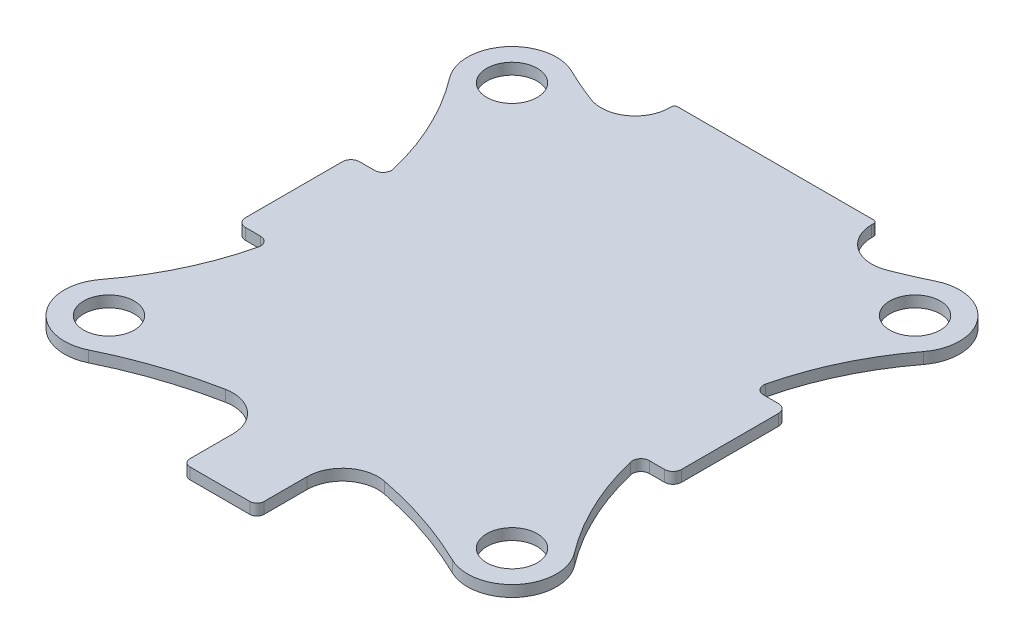
from build123d import *

# Parameters (mm, degrees)
SKETCH1_R           = 2.25
BOSS_EXTRUDE2_DEPTH = 1


with BuildPart() as part:
    # Sketch1 → Boss-Extrude2 (new body)
    with BuildSketch(Plane(origin=(0, 0, 0), x_dir=(1, 0, 0), z_dir=(0, 1, 0))):
        with BuildLine():
            Line((-18.669, -5.08), (-17.330956316, -5.08))
            ThreePointArc((-17.330956316, -5.08), (-16.732344988, -5.370503999), (-16.590161442, -6.020513179))
            ThreePointArc((-16.590161442, -6.020513179), (-18.359695736, -11.0243031), (-21.119367367, -15.557886415))
            ThreePointArc((-21.119367367, -15.557886415), (-21.028176895, -20.478529347), (-16.219689319, -21.527094936))
            ThreePointArc((-16.219689319, -21.527094936), (-11.752669663, -19.697385754), (-7.085365092, -18.465164862))
            ThreePointArc((-7.085365092, -18.465164862), (-4.458452771, -19.130602125), (-3.302, -21.581335094))
            Line((-3.302, -21.581335094), (-3.302, -25.4))
            ThreePointArc((-3.302, -25.4), (-3.116012806, -25.849012806), (-2.667, -26.035))
            Line((-2.667, -26.035), (2.667, -26.035))
            ThreePointArc((2.667, -26.035), (3.116012806, -25.849012806), (3.302, -25.4))
            Line((3.302, -25.4), (3.302, -21.581335094))
            ThreePointArc((3.302, -21.581335094), (4.458452771, -19.130602125), (7.085365092, -18.465164862))
            ThreePointArc((7.085365092, -18.465164862), (11.752669663, -19.697385754), (16.219689319, -21.527094936))
            ThreePointArc((16.219689319, -21.527094936), (21.028176895, -20.478529347), (21.119367367, -15.557886415))
            ThreePointArc((21.119367367, -15.557886415), (18.359695736, -11.0243031), (16.590161442, -6.020513179))
            ThreePointArc((16.590161442, -6.020513179), (16.732344988, -5.370503999), (17.330956316, -5.08))
            Line((17.330956316, -5.08), (18.669, -5.08))
            ThreePointArc((18.669, -5.08), (19.207815367, -4.856815367), (19.431, -4.318))
            Line((19.431, -4.318), (19.431, 4.318))
            ThreePointArc((19.431, 4.318), (19.207815367, 4.856815367), (18.669, 5.08))
            Line((18.669, 5.08), (17.330956316, 5.08))
            ThreePointArc((17.330956316, 5.08), (16.732344988, 5.370503999), (16.590161442, 6.020513179))
            ThreePointArc((16.590161442, 6.020513179), (18.359695736, 11.0243031), (21.119367367, 15.557886415))
            ThreePointArc((21.119367367, 15.557886415), (21.028176895, 20.478529347), (16.219689319, 21.527094936))
            ThreePointArc((16.219689319, 21.527094936), (14.699316522, 20.827163372), (13.148827901, 20.196748688))
            ThreePointArc((13.148827901, 20.196748688), (10.334855995, 20.536177996), (9.017, 23.045541604))
            Line((9.017, 23.045541604), (9.017, 23.241))
            ThreePointArc((9.017, 23.241), (8.942605122, 23.420605122), (8.763, 23.495))
            Line((8.763, 23.495), (-8.763, 23.495))
            ThreePointArc((-8.763, 23.495), (-8.942605122, 23.420605122), (-9.017, 23.241))
            Line((-9.017, 23.241), (-9.017, 23.045541604))
            ThreePointArc((-9.017, 23.045541604), (-10.334855995, 20.536177996), (-13.148827901, 20.196748688))
            ThreePointArc((-13.148827901, 20.196748688), (-14.699316522, 20.827163372), (-16.219689319, 21.527094936))
            ThreePointArc((-16.219689319, 21.527094936), (-21.028176895, 20.478529347), (-21.119367367, 15.557886415))
            ThreePointArc((-21.119367367, 15.557886415), (-18.359695736, 11.0243031), (-16.590161442, 6.020513179))
            ThreePointArc((-16.590161442, 6.020513179), (-16.732344988, 5.370503999), (-17.330956316, 5.08))
            Line((-17.330956316, 5.08), (-18.669, 5.08))
            ThreePointArc((-18.669, 5.08), (-19.207815367, 4.856815367), (-19.431, 4.318))
            Line((-19.431, 4.318), (-19.431, -4.318))
            ThreePointArc((-19.431, -4.318), (-19.207815367, -4.856815367), (-18.669, -5.08))
        make_face()
        with Locations((-17.960512242, -17.960512242)):
            Circle(SKETCH1_R, mode=Mode.SUBTRACT)
        with Locations((17.960512242, -17.960512242)):
            Circle(SKETCH1_R, mode=Mode.SUBTRACT)
        with Locations((-17.960512242, 17.960512242)):
            Circle(SKETCH1_R, mode=Mode.SUBTRACT)
        with Locations((17.960512242, 17.960512242)):
            Circle(SKETCH1_R, mode=Mode.SUBTRACT)
    extrude(amount=BOSS_EXTRUDE2_DEPTH)


solid = part.part
